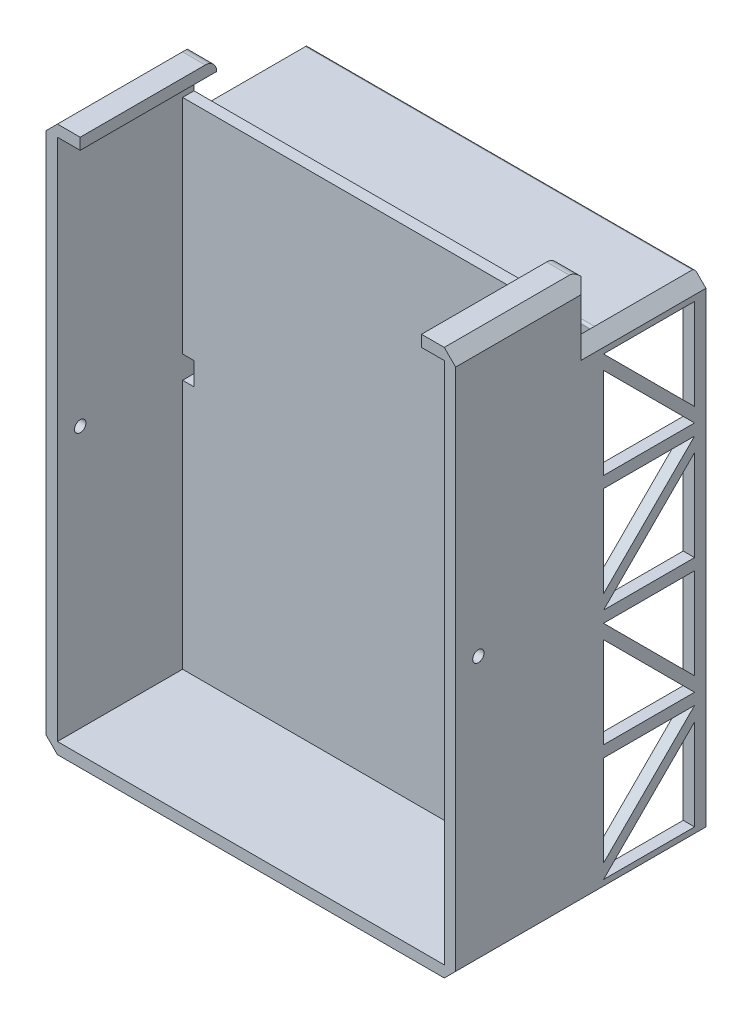
from build123d import *

# Parameters (mm, degrees)
SKETCH2_W                = 360
SKETCH2_H                = 220
BOSS_EXTRUDE1_DEPTH      = 480
SKETCH4_W                = 280
SKETCH4_H                = 110
CUT_EXTRUDE2_DEPTH       = 470
SKETCH5_W                = 110
SKETCH5_H                = 460
CUT_EXTRUDE3_DEPTH       = 40
SKETCH6_W                = 340
SKETCH6_H                = 100
CUT_EXTRUDE4_DEPTH       = 50
SKETCH7_W                = 340
SKETCH7_H                = 10
CUT_EXTRUDE5_DEPTH       = 420
SKETCH8_W                = 340
SKETCH8_H                = 410
CUT_EXTRUDE6_DEPTH       = 90
SKETCH12_W               = 10
SKETCH12_H               = 20
CUT_EXTRUDE9_DEPTH       = 10
CUT_EXTRUDE11_DEPTH      = 470
CUT_EXTRUDE11_DEPTH_BACK = 10
SKETCH18_W               = 100
SKETCH18_H               = 50
SKETCH23_W               = 110
SKETCH23_H               = 460
CUT_EXTRUDE13_DEPTH      = 20
SKETCH24_W               = 20
SKETCH24_H               = 110
CUT_EXTRUDE14_DEPTH      = 10
SKETCH26_R               = 5
CUT_EXTRUDE15_DEPTH      = 480
CUT_EXTRUDE16_DEPTH      = 480
SKETCH28_W               = 340
SKETCH28_H               = 10
CUT_EXTRUDE17_DEPTH      = 100
CHAMFER1_SIZE            = 10
CHAMFER2_SIZE            = 10
FILLET2_R                = 10
CHAMFER3_SIZE            = 10
FILLET4_R                = 2
FILLET5_R                = 2
CHAMFER4_SIZE            = 10
SKETCH29_W               = 340
SKETCH29_H               = 24.70137943
CUT_EXTRUDE18_DEPTH      = 10
SKETCH30_W               = 300
SKETCH30_H               = 27.571183361
CUT_EXTRUDE19_DEPTH      = 10


# Some blends are built 0.0001 mm under size
with BuildPart() as part:
    # Sketch2 → Boss-Extrude1 (new body)
    with BuildSketch(Plane(origin=(0, 0, 0), x_dir=(1, 0, 0), z_dir=(0, 1, 0))):
        with Locations((-139.181984943, -115.021725484)):
            Rectangle(SKETCH2_W, SKETCH2_H)
    extrude(amount=BOSS_EXTRUDE1_DEPTH)

    # Sketch4 → Cut-Extrude2 (cut)
    with BuildSketch(Plane(origin=(0, 480, 0), x_dir=(1, 0, 0), z_dir=(0, 1, 0))):
        with Locations((-129.181984943, -170.021725484)):
            Rectangle(SKETCH4_W, SKETCH4_H)
    extrude(amount=-CUT_EXTRUDE2_DEPTH, mode=Mode.SUBTRACT)

    # Sketch5 → Cut-Extrude3 (cut)
    with BuildSketch(Plane(origin=(-269.181984943, 0, 0), x_dir=(0, 0, -1), z_dir=(1, 0, 0))):
        with Locations((-170.021725484, 240)):
            Rectangle(SKETCH5_W, SKETCH5_H)
    extrude(amount=-CUT_EXTRUDE3_DEPTH, mode=Mode.SUBTRACT)

    # Sketch6 → Cut-Extrude4 (cut)
    with BuildSketch(Plane(origin=(0, 480, 0), x_dir=(1, 0, 0), z_dir=(0, 1, 0))):
        with Locations((-139.181984943, -55.021725484)):
            Rectangle(SKETCH6_W, SKETCH6_H)
    extrude(amount=-CUT_EXTRUDE4_DEPTH, mode=Mode.SUBTRACT)

    # Sketch7 → Cut-Extrude5 (cut)
    with BuildSketch(Plane(origin=(0, 430, 0), x_dir=(1, 0, 0), z_dir=(0, 1, 0))):
        with Locations((-139.181984943, -100.021725484)):
            Rectangle(SKETCH7_W, SKETCH7_H)
    extrude(amount=-CUT_EXTRUDE5_DEPTH, mode=Mode.SUBTRACT)

    # Sketch8 → Cut-Extrude6 (cut)
    with BuildSketch(Plane(origin=(0, 0, 5.021725484), x_dir=(-1, 0, 0), z_dir=(0, 0, -1))):
        with Locations((139.181984943, 215)):
            Rectangle(SKETCH8_W, SKETCH8_H)
    extrude(amount=-CUT_EXTRUDE6_DEPTH, mode=Mode.SUBTRACT)

    # Sketch12 → Cut-Extrude9 (cut)
    with BuildSketch(Plane(origin=(0, 0, 105.021725484), x_dir=(-1, 0, 0), z_dir=(0, 0, -1))):
        with Locations((-25.818015057, 240)):
            Rectangle(SKETCH12_W, SKETCH12_H)
        with Locations((304.181984943, 240)):
            Rectangle(SKETCH12_W, SKETCH12_H)
    extrude(amount=-CUT_EXTRUDE9_DEPTH, mode=Mode.SUBTRACT)

    # Sketch18 → Cut-Extrude11 (cut, two sides: drawn at the far end of the back side and taken through both)
    with BuildSketch(Plane(origin=(-309.181984943, 0, 0), x_dir=(0, 0, -1), z_dir=(1, 0, 0)).offset(-CUT_EXTRUDE11_DEPTH_BACK)):
        with Locations((-55.021725484, 455)):
            Rectangle(SKETCH18_W, SKETCH18_H)
    extrude(amount=CUT_EXTRUDE11_DEPTH + CUT_EXTRUDE11_DEPTH_BACK, mode=Mode.SUBTRACT)

    # Sketch23 → Cut-Extrude13 (cut)
    with BuildSketch(Plane.ZY.offset(-10.818015057)):
        with Locations((170.021725484, 240)):
            Rectangle(SKETCH23_W, SKETCH23_H)
    extrude(amount=-CUT_EXTRUDE13_DEPTH, mode=Mode.SUBTRACT)

    # Sketch24 → Cut-Extrude14 (cut)
    with BuildSketch(Plane(origin=(0, 480, 0), x_dir=(1, 0, 0), z_dir=(0, 1, 0))):
        with Locations((-279.181984943, -170.021725484)):
            Rectangle(SKETCH24_W, SKETCH24_H)
    extrude(amount=-CUT_EXTRUDE14_DEPTH, mode=Mode.SUBTRACT)

    # Sketch26 → Cut-Extrude15 (cut)
    with BuildSketch(Plane(origin=(40.818015057, 0, 0), x_dir=(0, 0, -1), z_dir=(1, 0, 0))):
        with Locations((-205.021725484, 240)):
            Circle(SKETCH26_R)
    extrude(amount=-CUT_EXTRUDE15_DEPTH, mode=Mode.SUBTRACT)

    # Sketch27 → Cut-Extrude16 (cut)
    with BuildSketch(Plane(origin=(40.818015057, 0, 0), x_dir=(0, 0, -1), z_dir=(1, 0, 0))):
        Polygon((-15.021725484, 335), (-95.021725484, 415), (-15.021725484, 415), align=None)
        Polygon((-15.021725484, 322.5), (-95.021725484, 402.5), (-95.021725484, 322.5), align=None)
        Polygon((-15.021725484, 312.5), (-95.021725484, 232.5), (-95.021725484, 312.5), align=None)
        Polygon((-15.021725484, 220), (-15.021725484, 300), (-95.021725484, 220), align=None)
        Polygon((-15.021725484, 130), (-95.021725484, 210), (-15.021725484, 210), align=None)
        Polygon((-95.021725484, 117.5), (-95.021725484, 197.5), (-15.021725484, 117.5), align=None)
        Polygon((-15.021725484, 107.5), (-95.021725484, 27.5), (-95.021725484, 107.5), align=None)
        Polygon((-15.021725484, 15), (-15.021725484, 95), (-95.021725484, 15), align=None)
    extrude(amount=-CUT_EXTRUDE16_DEPTH, mode=Mode.SUBTRACT)

    # Sketch28 → Cut-Extrude17 (cut)
    with BuildSketch(Plane(origin=(0, 0, 5.021725484), x_dir=(-1, 0, 0), z_dir=(0, 0, -1))):
        with Locations((139.181984943, 5)):
            Rectangle(SKETCH28_W, SKETCH28_H)
    extrude(amount=-CUT_EXTRUDE17_DEPTH, mode=Mode.SUBTRACT)

    # Chamfer1
    chamfer1_edges = [part.edges().sort_by_distance(p)[0] for p in [
        (40.818015057, 430, 55.021725484),
        (-319.181984943, 430, 55.021725484),
    ]]
    chamfer(chamfer1_edges, length=CHAMFER1_SIZE - 0.0001)  # a hair under: the kernel refuses the full size

    # Chamfer2
    chamfer2_edges = [part.edges().sort_by_distance(p)[0] for p in [
        (-319.181984943, 480, 165.021725484),
        (40.818015057, 480, 165.021725484),
    ]]
    chamfer(chamfer2_edges, length=CHAMFER2_SIZE)

    # Fillet2
    fillet2_edges = [part.edges().sort_by_distance(p)[0] for p in [
        (-139.181984943, 480, 105.021725484),
    ]]
    fillet(fillet2_edges, radius=FILLET2_R - 0.0001)  # a hair under: the kernel refuses the full size

    # Chamfer3
    # the kernel refuses this chamfer: 10 mm, written as the material it takes off along each edge
    with BuildSketch(Plane(origin=(-319.181984943, 495.71682988, 105.021725484), x_dir=(0.9996219169112968, 0, -0.027495876610586282), z_dir=(0, -1, 0))) as chamfer3_piece_1_section:
        Polygon((CHAMFER3_SIZE * 0.999621916911, CHAMFER3_SIZE * 0.0274958766106), (-CHAMFER3_SIZE * 0.0274958766106, CHAMFER3_SIZE * 0.999621916911), (0, 0), align=None)
    chamfer3_piece_1 = extrude(amount=101.433559759, mode=Mode.PRIVATE)
    chamfer3_piece_1 = split(chamfer3_piece_1, bisect_by=Plane(origin=(-315.895641605, 430, 108.325767027), z_dir=(0, 1, 0)), keep=Keep.TOP, mode=Mode.PRIVATE)
    chamfer3_piece_1 = split(chamfer3_piece_1, bisect_by=Plane(origin=(-309.181984943, 462.85841494, 108.325767027), z_dir=(-1, 0, 0)), keep=Keep.TOP, mode=Mode.PRIVATE)
    add(chamfer3_piece_1, mode=Mode.SUBTRACT)
    with BuildSketch(Plane(origin=(-319.181984943, 495.71682988, 105.021725484), x_dir=(0.9996219169112968, 0, -0.027495876610586282), z_dir=(0, -1, 0))) as chamfer3_piece_2_section:
        Polygon((CHAMFER3_SIZE * 0.999621916911, CHAMFER3_SIZE * 0.0274958766106), (-CHAMFER3_SIZE * 0.0274958766106, CHAMFER3_SIZE * 0.999621916911), (0, 0), align=None)
    chamfer3_piece_2 = extrude(amount=101.433559759, mode=Mode.PRIVATE)
    chamfer3_piece_2 = split(chamfer3_piece_2, bisect_by=Plane(origin=(-314.919016281, 424.263068662, 108.826082354), z_dir=(-0.7071067811865476, 0.7071067811865476, 0)), keep=Keep.TOP, mode=Mode.PRIVATE)
    chamfer3_piece_2 = split(chamfer3_piece_2, bisect_by=Plane(origin=(-316.831326727, 430, 108.826082354), z_dir=(0, -1, 0)), keep=Keep.TOP, mode=Mode.PRIVATE)
    add(chamfer3_piece_2, mode=Mode.SUBTRACT)
    with BuildSketch(Plane(origin=(40.818015057, 394.28327012, 105.021725484), x_dir=(-0.9996219169112968, 0, -0.027495876610586317), z_dir=(0, 1, 0))) as chamfer3_piece_3_section:
        Polygon((CHAMFER3_SIZE * 0.999621916911, CHAMFER3_SIZE * 0.0274958766106), (-CHAMFER3_SIZE * 0.0274958766106, CHAMFER3_SIZE * 0.999621916911), (0, 0), align=None)
    chamfer3_piece_3 = extrude(amount=101.433559759, mode=Mode.PRIVATE)
    chamfer3_piece_3 = split(chamfer3_piece_3, bisect_by=Plane(origin=(36.555046395, 424.263068662, 108.826082354), z_dir=(0.7071067811865485, 0.7071067811865467, 0)), keep=Keep.TOP, mode=Mode.PRIVATE)
    chamfer3_piece_3 = split(chamfer3_piece_3, bisect_by=Plane(origin=(38.46735684, 430, 108.826082354), z_dir=(0, -1, 0)), keep=Keep.TOP, mode=Mode.PRIVATE)
    add(chamfer3_piece_3, mode=Mode.SUBTRACT)
    with BuildSketch(Plane(origin=(40.818015057, 394.28327012, 105.021725484), x_dir=(-0.9996219169112968, 0, -0.027495876610586317), z_dir=(0, 1, 0))) as chamfer3_piece_4_section:
        Polygon((CHAMFER3_SIZE * 0.999621916911, CHAMFER3_SIZE * 0.0274958766106), (-CHAMFER3_SIZE * 0.0274958766106, CHAMFER3_SIZE * 0.999621916911), (0, 0), align=None)
    chamfer3_piece_4 = extrude(amount=101.433559759, mode=Mode.PRIVATE)
    chamfer3_piece_4 = split(chamfer3_piece_4, bisect_by=Plane(origin=(37.531671719, 430, 108.325767027), z_dir=(0, 1, 0)), keep=Keep.TOP, mode=Mode.PRIVATE)
    chamfer3_piece_4 = split(chamfer3_piece_4, bisect_by=Plane(origin=(30.818015057, 462.85841494, 108.325767027), z_dir=(1, 0, 0)), keep=Keep.TOP, mode=Mode.PRIVATE)
    add(chamfer3_piece_4, mode=Mode.SUBTRACT)

    # Fillet4
    fillet4_edges = [part.edges().sort_by_distance(p)[0] for p in [
        (-139.181984943, 0, 105.021725484),
        (-309.181984943, 0, 55.021725484),
        (30.818015057, 0, 55.021725484),
        (-139.181984943, 430, 5.021725484),
        (30.818015057, 210, 5.021725484),
        (-139.181984943, 420, 5.021725484),
        (-309.181984943, 210, 5.021725484),
    ]]
    fillet(fillet4_edges, radius=FILLET4_R)

    # Fillet5
    fillet5_edges = [part.edges().sort_by_distance(p)[0] for p in [
        (-139.181984943, 430, 95.021725484),
    ]]
    fillet(fillet5_edges, radius=FILLET5_R)

    # Chamfer4
    # the kernel refuses this chamfer: 10 mm, written as the material it takes off along each edge
    with BuildSketch(Plane(origin=(-319.181984943, 0, 250.738555364), x_dir=(0.9996219169112968, -0.027495876610586334, 0), z_dir=(0, 0, -1))) as chamfer4_piece_1:
        Polygon((CHAMFER4_SIZE * 0.999621916911, -CHAMFER4_SIZE * 0.0274958766106), (-CHAMFER4_SIZE * 0.0274958766106, -CHAMFER4_SIZE * 0.999621916911), (0, 0), align=None)
    extrude(amount=271.433659759, mode=Mode.SUBTRACT)
    with BuildSketch(Plane(origin=(40.818015057, 0, -20.695104396), x_dir=(0.027495876610586317, 0.9996219169112968, 0), z_dir=(0, 0, 1))) as chamfer4_piece_2:
        Polygon((CHAMFER4_SIZE * 0.999621916911, CHAMFER4_SIZE * 0.0274958766106), (-CHAMFER4_SIZE * 0.0274958766106, CHAMFER4_SIZE * 0.999621916911), (0, 0), align=None)
    extrude(amount=271.433659759, mode=Mode.SUBTRACT)

    # Sketch29 → Cut-Extrude18 (cut)
    with BuildSketch(Plane(origin=(0, 0, 105.021725484), x_dir=(-1, 0, 0), z_dir=(0, 0, -1))):
        with Locations((139.181984943, 457.649310285)):
            Rectangle(SKETCH29_W, SKETCH29_H)
    extrude(amount=-CUT_EXTRUDE18_DEPTH, mode=Mode.SUBTRACT)

    # Sketch30 → Cut-Extrude19 (cut)
    with BuildSketch(Plane(origin=(0, 480, 0), x_dir=(1, 0, 0), z_dir=(0, 1, 0))):
        with Locations((-139.181984943, -101.236133803)):
            Rectangle(SKETCH30_W, SKETCH30_H)
    extrude(amount=-CUT_EXTRUDE19_DEPTH, mode=Mode.SUBTRACT)


solid = part.part
